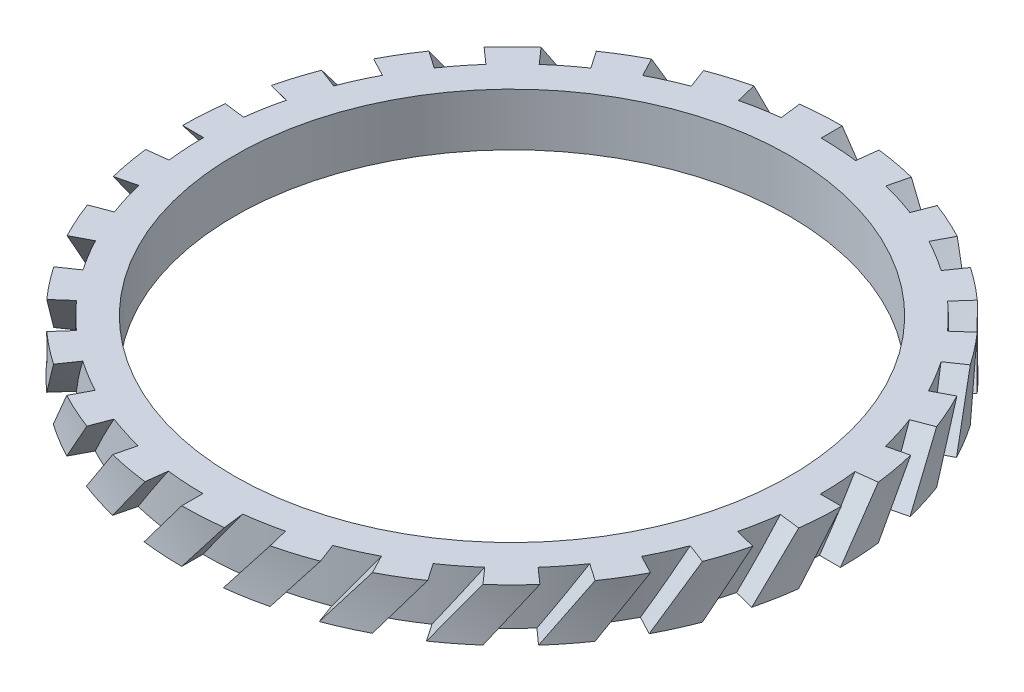
from build123d import *

# Parameters (mm, degrees)
SKETCH2_R           = 44
SKETCH2_R_2         = 39.6
BOSS_EXTRUDE2_DEPTH = 7.5
CIRPATTERN1_COUNT   = 26


with BuildPart() as part:
    # Sketch2 → Boss-Extrude2 (new body)
    with BuildSketch(Plane(origin=(0, 0, 0), x_dir=(1, 0, 0), z_dir=(0, 1, 0))):
        with Locations(Location((0, 0, 0), (0, 0, 270))):
            Circle(SKETCH2_R)
        with Locations(Location((0, 0, 0), (0, 0, 270))):
            Circle(SKETCH2_R_2, mode=Mode.SUBTRACT)
    extrude(amount=-BOSS_EXTRUDE2_DEPTH)

    # Loft1: read off the stored shape, not the designer's step
    # Loft1: loft between two sections, ruled curve by curve
    loft1_from = [
        Edge.make_bspline([(5.449196716, -7.5, -43.661267219), (5.511119406, -7.5, -44.157417983), (5.573042096, -7.5, -44.653568746), (5.696887476, -7.5, -45.645870274), (5.758810166, -7.5, -46.142021038), (5.820732856, -7.5, -46.638171802)], [0, 0, 0, 0, 0.5, 0.5, 1, 1, 1, 1], 3),
        Edge.make_bspline([(0.093582621, -7.5, -46.999906833), (0.092587061, -7.5, -46.499907824), (0.091591501, -7.5, -45.999908815), (0.089600381, -7.5, -44.999910797), (0.088604822, -7.5, -44.499911789), (0.087609262, -7.5, -43.99991278)], [0, 0, 0, 0, 0.5, 0.5, 1, 1, 1, 1], 3),
        Edge.make_bspline([(5.820732856, -7.5, -46.638171802), (3.920241473, -7.5, -46.875364904), (2.008814597, -7.5, -46.996093369), (0.093582621, -7.5, -46.999906833)], [0, 0, 0, 0, 1, 1, 1, 1], 3, [1, 0.998756532, 0.998756532, 1]),
        Edge.make_line((0.087609262, -7.5, -43.99991278), (5.449196716, -7.5, -43.661267219)),
    ]
    loft1_to = [
        Edge.make_bspline([(0.087967663, 0, -43.999912065), (0.088903489, 0, -44.499911193), (0.089839315, 0, -44.999910321), (0.091710968, 0, -45.999908577), (0.092646794, 0, -46.499907705), (0.093582621, 0, -46.999906833)], [0, 0, 0, 0, 0.5, 0.5, 1, 1, 1, 1], 3),
        Edge.make_bspline([(-5.640537132, 0, -46.660307981), (-5.580531418, 0, -46.163921726), (-5.520525704, 0, -45.667535471), (-5.400514275, 0, -44.67476296), (-5.340508561, 0, -44.178376705), (-5.280502847, 0, -43.68199045)], [0, 0, 0, 0, 0.5, 0.5, 1, 1, 1, 1], 3),
        Edge.make_bspline([(0.093582621, 0, -46.999906833), (-1.823524505, 0, -47.00372403), (-3.737282106, 0, -46.890383201), (-5.640537132, 0, -46.660307981)], [0, 0, 0, 0, 1, 1, 1, 1], 3, [1, 0.9987541, 0.9987541, 1]),
        Edge.make_line((-5.280502847, 0, -43.68199045), (0.087967663, 0, -43.999912065)),
    ]
    loft1 = Solid(Shell([*[Face.make_surface_from_curves(loft1_from[k], loft1_to[k]) for k in range(4)], Face(Wire(loft1_from)), Face(Wire(loft1_to))]))
    add(loft1)

    # CirPattern1: Loft1 ×26 about axis
    cirpattern1_axis = Axis((0, 0, 0), (0, 1, 0))
    for i in range(1, CIRPATTERN1_COUNT):
        add(loft1.rotate(cirpattern1_axis, i * 360 / CIRPATTERN1_COUNT))


solid = part.part
